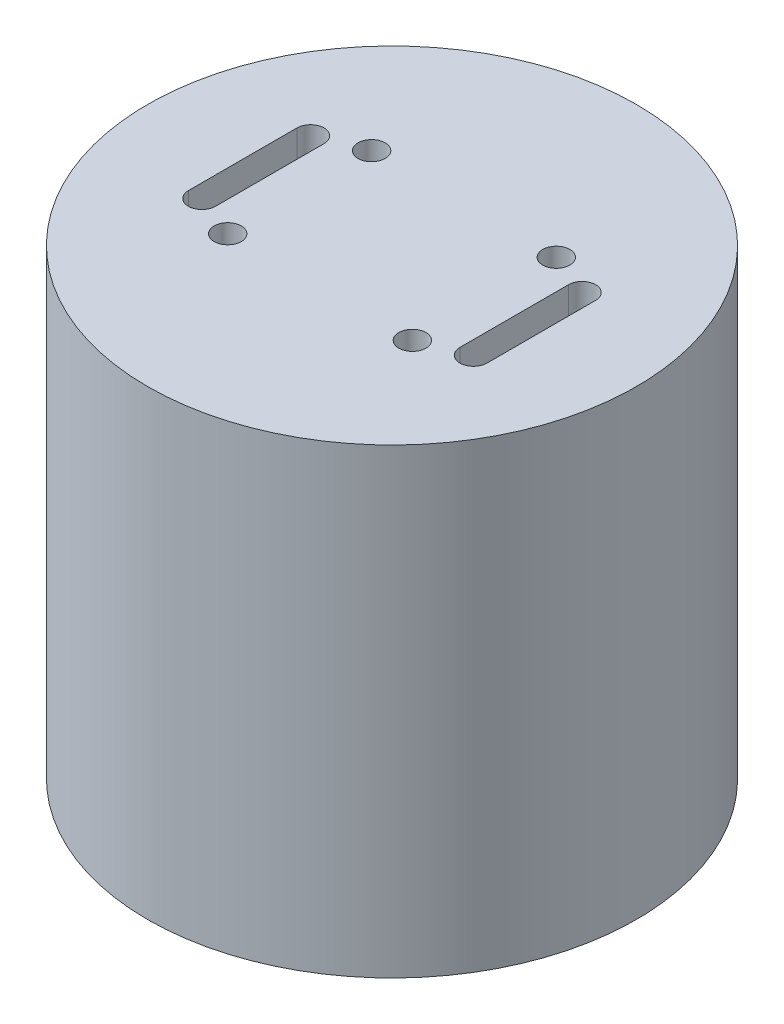
from build123d import *

# Parameters (mm, degrees)
SKETCH1_R           = 90
BOSS_EXTRUDE1_DEPTH = 10
SKETCH2_R           = 5
CUT_EXTRUDE1_DEPTH  = 128.671453348
BOSS_EXTRUDE2_START = 150
SKETCH3_R           = 90
SKETCH3_R_2         = 80
BOSS_EXTRUDE2_DEPTH = 150
CUT_EXTRUDE2_DEPTH  = 205.450483003
BOSS_EXTRUDE4_START = 10
SKETCH8_R           = 90
BOSS_EXTRUDE4_DEPTH = 10
CUT_EXTRUDE3_REACH  = 214.368
SKETCH9_R           = 1.5


with BuildPart() as part:
    # Sketch1 → Boss-Extrude1 (new body)
    with BuildSketch(Plane(origin=(0, 0, 0), x_dir=(1, 0, 0), z_dir=(0, 1, 0))):
        Circle(SKETCH1_R)
    extrude(amount=BOSS_EXTRUDE1_DEPTH)

    # Sketch2 → Cut-Extrude1 (cut, through all)
    with BuildSketch(Plane(origin=(0, 10, 0), x_dir=(1, 0, 0), z_dir=(0, 1, 0))):
        with Locations((-34, -26.5)):
            Circle(SKETCH2_R)
        with Locations((34, -26.5)):
            Circle(SKETCH2_R)
        with Locations((34, 26.5)):
            Circle(SKETCH2_R)
        with Locations((-34, 26.5)):
            Circle(SKETCH2_R)
    extrude(amount=-CUT_EXTRUDE1_DEPTH, mode=Mode.SUBTRACT)

    # Sketch3 → Boss-Extrude2 (add)
    with BuildSketch(Plane.XZ.offset(BOSS_EXTRUDE2_START)):
        Circle(SKETCH3_R)
        Circle(SKETCH3_R_2, mode=Mode.SUBTRACT)
    extrude(amount=-BOSS_EXTRUDE2_DEPTH)

    # Sketch4 → Cut-Extrude2 (cut, through all)
    with BuildSketch(Plane(origin=(0, 10, 0), x_dir=(1, 0, 0), z_dir=(0, 1, 0))):
        with BuildLine():
            Line((55, 20), (55, -20))
            ThreePointArc((55, -20), (50, -25), (45, -20))
            Line((45, -20), (45, 20))
            ThreePointArc((45, 20), (50, 25), (55, 20))
        make_face()
    cut_extrude2 = extrude(amount=-CUT_EXTRUDE2_DEPTH, mode=Mode.SUBTRACT)

    # Mirror1: Cut-Extrude2 across plane
    add(cut_extrude2.mirror(Plane(origin=(0, 0, 0), x_dir=(0, 0, 1), z_dir=(1, 0, 0))), mode=Mode.SUBTRACT)

    # Sketch8 → Boss-Extrude4 (add)
    with BuildSketch(Plane.XZ.offset(150).offset(BOSS_EXTRUDE4_START)):
        Circle(SKETCH8_R)
    extrude(amount=-BOSS_EXTRUDE4_DEPTH)

    # Sketch9 → Cut-Extrude3 (cut, up to next)
    with BuildSketch(Plane.XZ.offset(160), mode=Mode.PRIVATE) as cut_extrude3_sk1:
        with Locations((6.5, 15.5)):
            Circle(SKETCH9_R)
    cut_extrude3_tool1 = extrude(cut_extrude3_sk1.sketch, amount=-CUT_EXTRUDE3_REACH, mode=Mode.PRIVATE) & part.part
    # Sketch9 → Cut-Extrude3 (cut, up to next)
    with BuildSketch(Plane.XZ.offset(160), mode=Mode.PRIVATE) as cut_extrude3_sk2:
        with Locations((37.5, 15.5)):
            Circle(SKETCH9_R)
    cut_extrude3_tool2 = extrude(cut_extrude3_sk2.sketch, amount=-CUT_EXTRUDE3_REACH, mode=Mode.PRIVATE) & part.part
    # Sketch9 → Cut-Extrude3 (cut, up to next)
    with BuildSketch(Plane.XZ.offset(160), mode=Mode.PRIVATE) as cut_extrude3_sk3:
        with Locations((6.5, -15.5)):
            Circle(SKETCH9_R)
    cut_extrude3_tool3 = extrude(cut_extrude3_sk3.sketch, amount=-CUT_EXTRUDE3_REACH, mode=Mode.PRIVATE) & part.part
    # Sketch9 → Cut-Extrude3 (cut, up to next)
    with BuildSketch(Plane.XZ.offset(160), mode=Mode.PRIVATE) as cut_extrude3_sk4:
        with Locations((37.5, -15.5)):
            Circle(SKETCH9_R)
    cut_extrude3_tool4 = extrude(cut_extrude3_sk4.sketch, amount=-CUT_EXTRUDE3_REACH, mode=Mode.PRIVATE) & part.part
    # Sketch9 → Cut-Extrude3 (cut, up to next)
    with BuildSketch(Plane.XZ.offset(160), mode=Mode.PRIVATE) as cut_extrude3_sk5:
        with Locations((-6.5, -15.5)):
            Circle(SKETCH9_R)
    cut_extrude3_tool5 = extrude(cut_extrude3_sk5.sketch, amount=-CUT_EXTRUDE3_REACH, mode=Mode.PRIVATE) & part.part
    # Sketch9 → Cut-Extrude3 (cut, up to next)
    with BuildSketch(Plane.XZ.offset(160), mode=Mode.PRIVATE) as cut_extrude3_sk6:
        with Locations((-37.5, -15.5)):
            Circle(SKETCH9_R)
    cut_extrude3_tool6 = extrude(cut_extrude3_sk6.sketch, amount=-CUT_EXTRUDE3_REACH, mode=Mode.PRIVATE) & part.part
    # Sketch9 → Cut-Extrude3 (cut, up to next)
    with BuildSketch(Plane.XZ.offset(160), mode=Mode.PRIVATE) as cut_extrude3_sk7:
        with Locations((-37.5, 15.5)):
            Circle(SKETCH9_R)
    cut_extrude3_tool7 = extrude(cut_extrude3_sk7.sketch, amount=-CUT_EXTRUDE3_REACH, mode=Mode.PRIVATE) & part.part
    # Sketch9 → Cut-Extrude3 (cut, up to next)
    with BuildSketch(Plane.XZ.offset(160), mode=Mode.PRIVATE) as cut_extrude3_sk8:
        with Locations((-6.5, 15.5)):
            Circle(SKETCH9_R)
    cut_extrude3_tool8 = extrude(cut_extrude3_sk8.sketch, amount=-CUT_EXTRUDE3_REACH, mode=Mode.PRIVATE) & part.part
    add(cut_extrude3_tool1.solids().sort_by_distance((6.5, -160, 15.5))[0], mode=Mode.SUBTRACT)
    add(cut_extrude3_tool2.solids().sort_by_distance((37.5, -160, 15.5))[0], mode=Mode.SUBTRACT)
    add(cut_extrude3_tool3.solids().sort_by_distance((6.5, -160, -15.5))[0], mode=Mode.SUBTRACT)
    add(cut_extrude3_tool4.solids().sort_by_distance((37.5, -160, -15.5))[0], mode=Mode.SUBTRACT)
    add(cut_extrude3_tool5.solids().sort_by_distance((-6.5, -160, -15.5))[0], mode=Mode.SUBTRACT)
    add(cut_extrude3_tool6.solids().sort_by_distance((-37.5, -160, -15.5))[0], mode=Mode.SUBTRACT)
    add(cut_extrude3_tool7.solids().sort_by_distance((-37.5, -160, 15.5))[0], mode=Mode.SUBTRACT)
    add(cut_extrude3_tool8.solids().sort_by_distance((-6.5, -160, 15.5))[0], mode=Mode.SUBTRACT)


solid = part.part
